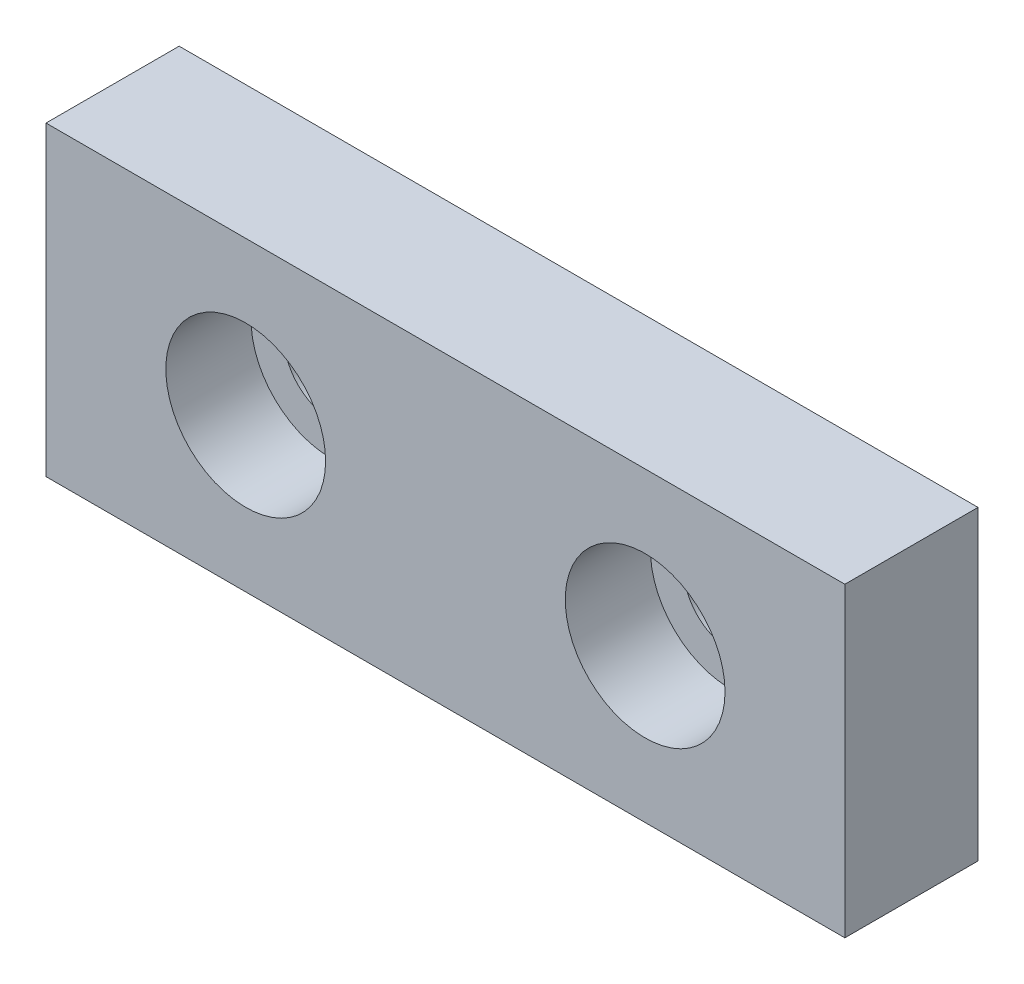
from build123d import *

# Parameters (mm, degrees)
SKETCH1_W           = 30
SKETCH1_H           = 11.5
BOSS_EXTRUDE1_DEPTH = 5
SKETCH2_R           = 1.75
CUT_EXTRUDE1_DEPTH  = 17.824461358
SKETCH3_R           = 3
CUT_EXTRUDE4_DEPTH  = 3.2


with BuildPart() as part:
    # Sketch1 → Boss-Extrude1 (new body)
    with BuildSketch(Plane.XY):
        Rectangle(SKETCH1_W, SKETCH1_H)
    extrude(amount=BOSS_EXTRUDE1_DEPTH)

    # Sketch2 → Cut-Extrude1 (cut, through all)
    with BuildSketch(Plane.XY.offset(5)):
        with Locations((-7.5, 0)):
            Circle(SKETCH2_R)
        with Locations((7.5, 0)):
            Circle(SKETCH2_R)
    extrude(amount=-CUT_EXTRUDE1_DEPTH, mode=Mode.SUBTRACT)

    # Sketch3 → Cut-Extrude4 (cut)
    with BuildSketch(Plane.XY.offset(5)):
        with Locations((-7.5, 0)):
            Circle(SKETCH3_R)
        with Locations((7.5, 0)):
            Circle(SKETCH3_R)
    extrude(amount=-CUT_EXTRUDE4_DEPTH, mode=Mode.SUBTRACT)


solid = part.part
